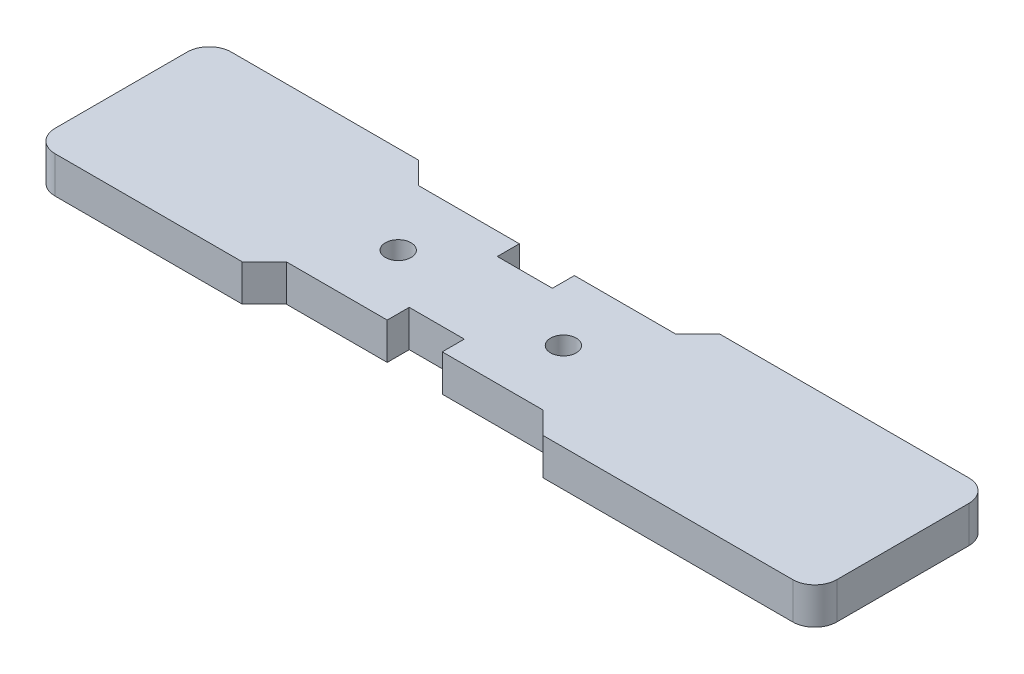
from build123d import *

# Parameters (mm, degrees)
BOSS_EXTRUDE1_DEPTH = 5
SKETCH5_R           = 5
BOSS_EXTRUDE2_DEPTH = 4
SKETCH7_W           = 35
SKETCH7_H           = 3
CUT_EXTRUDE2_DEPTH  = 59.951251047
SKETCH6_W           = 7.5
SKETCH6_H           = 3
CUT_EXTRUDE1_DEPTH  = 59.951251047
SKETCH8_R           = 1.75
CUT_EXTRUDE3_DEPTH  = 59.951251047
FILLET3_R           = 3
FILLET2_R           = 0.25
CHAMFER1_SIZE       = 3


with BuildPart() as part:
    # Sketch1 → Boss-Extrude1 (new body)
    with BuildSketch(Plane(origin=(0, 0, 0), x_dir=(1, 0, 0), z_dir=(0, 1, 0))):
        Polygon((0, 12), (57.5, 12), (57.5, -12), (0, -12), (-49, -12), (-49, 12), align=None)
    extrude(amount=BOSS_EXTRUDE1_DEPTH)

    # Sketch5 → Boss-Extrude2 (add)
    with BuildSketch(Plane(origin=(0, 0, 0), x_dir=(1, 0, 0), z_dir=(0, 1, 0))):
        with Locations(Location((-37, 0, 0), (0, 0, 270))):
            Circle(SKETCH5_R)
        with Locations(Location((45.5, 0, 0), (0, 0, 90))):
            Circle(SKETCH5_R)
    extrude(amount=-BOSS_EXTRUDE2_DEPTH)

    # Sketch7 → Cut-Extrude2 (cut, through all)
    with BuildSketch(Plane.XZ):
        with Locations((0, 10.5)):
            Rectangle(SKETCH7_W, SKETCH7_H)
        with Locations((0, -10.5)):
            Rectangle(SKETCH7_W, SKETCH7_H)
    extrude(amount=-CUT_EXTRUDE2_DEPTH, mode=Mode.SUBTRACT)

    # Sketch6 → Cut-Extrude1 (cut, through all)
    with BuildSketch(Plane.XZ):
        with Locations((0, 7.5)):
            Rectangle(SKETCH6_W, SKETCH6_H)
        with Locations((0, -7.5)):
            Rectangle(SKETCH6_W, SKETCH6_H)
    extrude(amount=-CUT_EXTRUDE1_DEPTH, mode=Mode.SUBTRACT)

    # Sketch8 → Cut-Extrude3 (cut, through all)
    with BuildSketch(Plane.XZ):
        with Locations(Location((-11.25, 0, 0), (0, 0, 270))):
            Circle(SKETCH8_R)
        with Locations(Location((11.25, 0, 0), (0, 0, 90))):
            Circle(SKETCH8_R)
    extrude(amount=-CUT_EXTRUDE3_DEPTH, mode=Mode.SUBTRACT)

    # Fillet3
    fillet3_edges = [part.edges().sort_by_distance(p)[0] for p in [
        (-49, 2.5, 12),
        (-49, 2.5, -12),
        (57.5, 2.5, -12),
        (57.5, 2.5, 12),
    ]]
    fillet(fillet3_edges, radius=FILLET3_R)

    # Fillet2
    fillet2_edges = [part.edges().sort_by_distance(p)[0] for p in [
        (-37, -4, -5),
        (45.5, -4, 5),
    ]]
    fillet(fillet2_edges, radius=FILLET2_R)

    # Chamfer1
    chamfer1_edges = [part.edges().sort_by_distance(p)[0] for p in [
        (17.5, 2.5, 12),
        (-17.5, 2.5, 12),
        (17.5, 2.5, -12),
        (-17.5, 2.5, -12),
    ]]
    chamfer(chamfer1_edges, length=CHAMFER1_SIZE - 0.0001)  # a hair under: the kernel refuses the full size


solid = part.part
